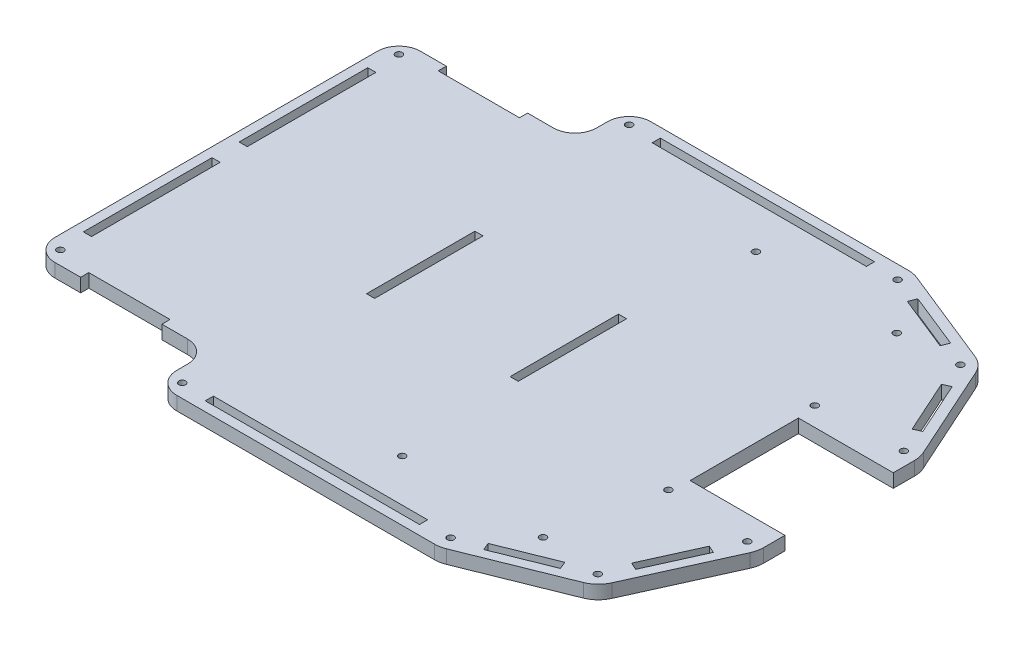
from build123d import *

# Parameters (mm, degrees)
ESTRUSIONE_ESTRUSIONE1_DEPTH  = 5
FORO_FILETTATO_M3X0_5_1_D     = 2.5
FORO_FILETTATO_M3X0_5_1_DEPTH = 7.5
FORO_FILETTATO_M3X0_5_1_TIP   = 0.751075774
SCHIZZO26_W                   = 30
SCHIZZO26_H                   = 3
TAGLIO_ESTRUSIONE12_DEPTH     = 10
SCHIZZO4_W                    = 79.084596206
SCHIZZO4_H                    = 3
TAGLIO_ESTRUSIONE2_DEPTH      = 10
SCHIZZO7_W                    = 3
SCHIZZO7_H                    = 47.5
TAGLIO_ESTRUSIONE5_DEPTH      = 10
SCHIZZO12_W                   = 3
SCHIZZO12_H                   = 40
TAGLIO_ESTRUSIONE8_DEPTH      = 247.132586221
TAGLIO_ESTRUSIONE1_DEPTH      = 247.132586221
TAGLIO_ESTRUSIONE1_DEPTH_BACK = 247.132586221
FORO_FILETTATO_M3X0_5_4_D     = 2.5
FORO_FILETTATO_M3X0_5_5_D     = 2.5
RACCORDO1_R                   = 8
RACCORDO2_R                   = 10


with BuildPart() as part:
    # Schizzo1 → Estrusione-Estrusione1 (new body)
    with BuildSketch(Plane(origin=(0, 0, 0), x_dir=(1, 0, 0), z_dir=(0, 1, 0))):
        Polygon((65, 67.5), (65, 87.5), (170.052105959, 87.5), (211.585225273, 70.801270189), (230, 30), (230, -30), (211.585225273, -70.801270189), (170.052105959, -87.5), (65, -87.5), (65, -67.5), (0, -67.5), (0, 67.5), align=None)
    extrude(amount=ESTRUSIONE_ESTRUSIONE1_DEPTH)

    # Foro filettato M3x0.5-1
    with Locations(Plane(origin=(0, 5, 0), x_dir=(1, 0, 0), z_dir=(0, 1, 0))):
        with Locations((207.854862265, 66.912097904), (225, 28.92393853), (225, -28.92393853), (207.854862265, -66.912097904), (169.084596206, -82.5), (169.084596206, 82.5), (70, 82.5), (70, -82.5), (5, -62.5), (5, 62.5)):
            Hole(FORO_FILETTATO_M3X0_5_1_D / 2, depth=FORO_FILETTATO_M3X0_5_1_DEPTH)
            with Locations((0, 0, -(FORO_FILETTATO_M3X0_5_1_DEPTH + FORO_FILETTATO_M3X0_5_1_TIP / 2))):  # 118° drill point
                Cone(0, FORO_FILETTATO_M3X0_5_1_D / 2, FORO_FILETTATO_M3X0_5_1_TIP, mode=Mode.SUBTRACT)

    # Schizzo26 → Taglio-Estrusione12 (cut)
    with BuildSketch(Plane(origin=(0, 5, 0), x_dir=(1, 0, 0), z_dir=(0, 1, 0))):
        with Locations((32.5, -66)):
            Rectangle(SCHIZZO26_W, SCHIZZO26_H)
    taglio_estrusione12 = extrude(amount=-TAGLIO_ESTRUSIONE12_DEPTH, mode=Mode.SUBTRACT)

    # Specchia1: Taglio-Estrusione12 across plane
    add(taglio_estrusione12.mirror(Plane.XY), mode=Mode.SUBTRACT)

    # Schizzo4 → Taglio-Estrusione2 (cut)
    with BuildSketch(Plane(origin=(0, 5, 0), x_dir=(1, 0, 0), z_dir=(0, 1, 0))):
        with Locations((119.542298103, -82.5)):
            Rectangle(SCHIZZO4_W, SCHIZZO4_H)
        Polygon((219.519084515, 37.421559693), (210.601374282, 57.180362615), (213.33577775, 58.414476741), (222.253487983, 38.655673819), align=None)
        with Locations((119.542298103, 82.5)):
            Rectangle(SCHIZZO4_W, SCHIZZO4_H)
        Polygon((199.136249234, 72.034186035), (178.92231814, 80.161362114), (177.803209237, 77.377911869), (198.017140331, 69.250735791), align=None)
        Polygon((177.803209237, -77.377911869), (198.017140331, -69.250735791), (199.136249234, -72.034186035), (178.92231814, -80.161362114), align=None)
        Polygon((210.601374282, -57.180362615), (219.519084515, -37.421559693), (222.253487983, -38.655673819), (213.33577775, -58.414476741), align=None)
    extrude(amount=-TAGLIO_ESTRUSIONE2_DEPTH, mode=Mode.SUBTRACT)

    # Schizzo7 → Taglio-Estrusione5 (cut)
    with BuildSketch(Plane(origin=(0, 5, 0), x_dir=(1, 0, 0), z_dir=(0, 1, 0))):
        with Locations((5, 28.75)):
            Rectangle(SCHIZZO7_W, SCHIZZO7_H)
        with Locations((5, -28.75)):
            Rectangle(SCHIZZO7_W, SCHIZZO7_H)
    extrude(amount=-TAGLIO_ESTRUSIONE5_DEPTH, mode=Mode.SUBTRACT)

    # Schizzo12 → Taglio-Estrusione8 (cut, through all)
    with BuildSketch(Plane(origin=(0, 5, 0), x_dir=(1, 0, 0), z_dir=(0, 1, 0))):
        with Locations((77.042298103, 0)):
            Rectangle(SCHIZZO12_W, SCHIZZO12_H)
        with Locations((130.042298103, 0)):
            Rectangle(SCHIZZO12_W, SCHIZZO12_H)
    extrude(amount=-TAGLIO_ESTRUSIONE8_DEPTH, mode=Mode.SUBTRACT)

    # Schizzo2 → Taglio-Estrusione1 (cut, two sides: drawn at the far end of the back side and taken through both)
    with BuildSketch(Plane(origin=(0, 5, 0), x_dir=(1, 0, 0), z_dir=(0, 1, 0)).offset(-TAGLIO_ESTRUSIONE1_DEPTH_BACK)):
        Polygon((747.76470929, 20), (230, 20), (195, 20), (195, -20), (230, -20), (747.76470929, -20), (1783.294127869, -20), (1783.294127869, 20), align=None)
    extrude(amount=TAGLIO_ESTRUSIONE1_DEPTH + TAGLIO_ESTRUSIONE1_DEPTH_BACK, mode=Mode.SUBTRACT)

    # Foro filettato M3x0.5-4 (through all)
    with Locations(Plane(origin=(0, 5, 0), x_dir=(1, 0, 0), z_dir=(0, 1, 0))):
        with Locations((194, 27), (194, -27)):
            Hole(FORO_FILETTATO_M3X0_5_4_D / 2)

    # Foro filettato M3x0.5-5 (through all)
    with Locations(Plane(origin=(0, 5, 0), x_dir=(1, 0, 0), z_dir=(0, 1, 0))):
        with Locations((133.986816105, 65.3), (185.986816105, 65.3), (185.986816105, -65.3), (133.986816105, -65.3)):
            Hole(FORO_FILETTATO_M3X0_5_5_D / 2)

    # Raccordo1
    raccordo1_edges = [part.edges().sort_by_distance(p)[0] for p in [
        (0, 2.5, 67.5),
        (0, 2.5, -67.5),
        (65, 2.5, -87.5),
        (65, 2.5, 87.5),
        (65, 2.5, 67.5),
        (65, 2.5, -67.5),
    ]]
    fillet(raccordo1_edges, radius=RACCORDO1_R)

    # Raccordo2
    raccordo2_edges = [part.edges().sort_by_distance(p)[0] for p in [
        (170.052105959, 2.5, -87.5),
        (211.585225273, 2.5, -70.801270189),
        (230, 2.5, -30),
        (230, 2.5, 30),
        (211.585225273, 2.5, 70.801270189),
        (170.052105959, 2.5, 87.5),
    ]]
    fillet(raccordo2_edges, radius=RACCORDO2_R)


solid = part.part
